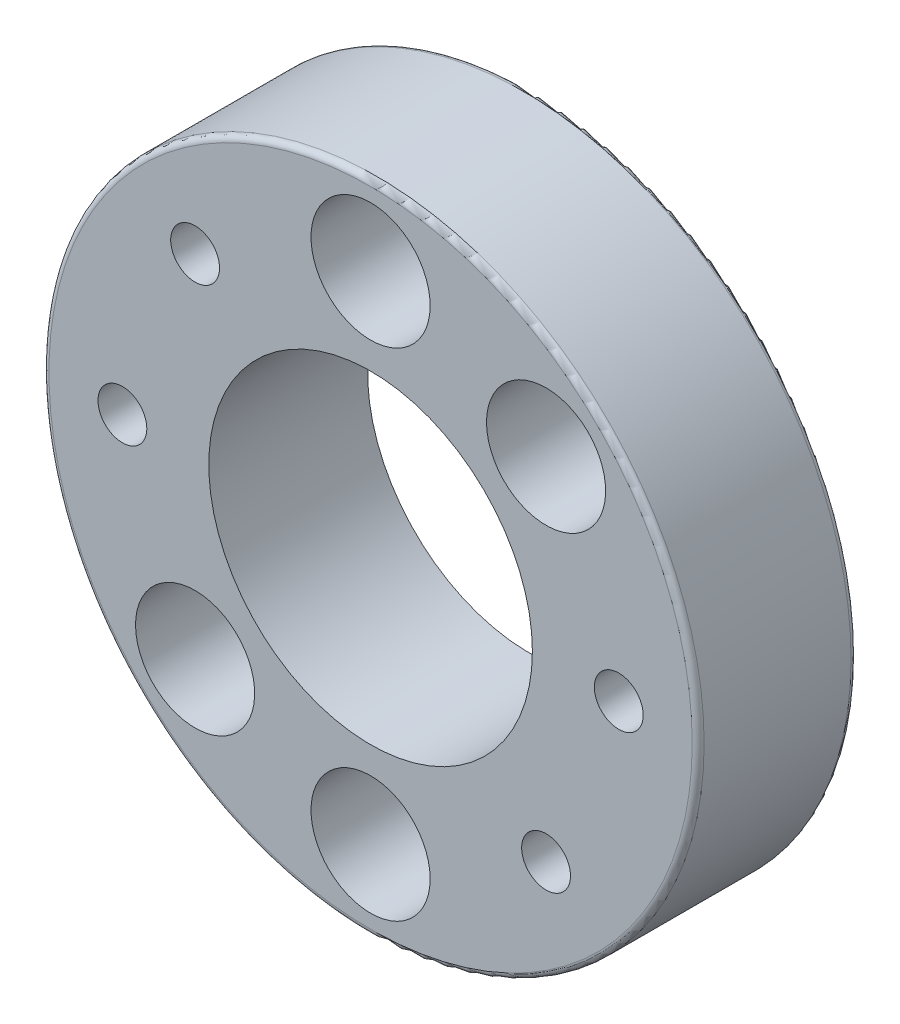
from build123d import *

# Parameters (mm, degrees)
SKETCH1_R           = 16.5
SKETCH1_R_2         = 8.15
BOSS_EXTRUDE1_DEPTH = 8
SKETCH2_R           = 3
CUT_EXTRUDE1_DEPTH  = 25.667792767
TAP1_D              = 2.459
CIRPATTERN11_COUNT  = 2
CIRPATTERN11_ANGLE  = 45
FILLET1_R           = 0.3


with BuildPart() as part:
    # Sketch1 → Boss-Extrude1 (new body)
    with BuildSketch(Plane.XY):
        Circle(SKETCH1_R)
        Circle(SKETCH1_R_2, mode=Mode.SUBTRACT)
    extrude(amount=BOSS_EXTRUDE1_DEPTH)

    # Sketch2 → Cut-Extrude1 (cut, through all)
    with BuildSketch(Plane.XY.offset(8)):
        with Locations((0, 12.5)):
            Circle(SKETCH2_R)
        with Locations((0, -12.5)):
            Circle(SKETCH2_R)
    cut_extrude1 = extrude(amount=-CUT_EXTRUDE1_DEPTH, mode=Mode.SUBTRACT)

    # Tap1 (through all)
    with Locations(Plane.XY.offset(8)):
        with Locations((-12.5, 0), (12.5, 0)):
            tap1 = Hole(TAP1_D / 2)

    # CirPattern11: Cut-Extrude1, Tap1 ×2 about axis
    cirpattern11_axis = Axis((0, 0, -0.15), (0, 0, -1))
    add([cut_extrude1.rotate(cirpattern11_axis, i * CIRPATTERN11_ANGLE / (CIRPATTERN11_COUNT - 1)) for i in range(1, CIRPATTERN11_COUNT)], mode=Mode.SUBTRACT)
    add([tap1.rotate(cirpattern11_axis, i * CIRPATTERN11_ANGLE / (CIRPATTERN11_COUNT - 1)) for i in range(1, CIRPATTERN11_COUNT)], mode=Mode.SUBTRACT)

    # Fillet1
    fillet1_edges = [part.edges().sort_by_distance(p)[0] for p in [
        (-16.5, 0, 0),
        (-16.5, 0, 8),
    ]]
    fillet(fillet1_edges, radius=FILLET1_R)


solid = part.part
